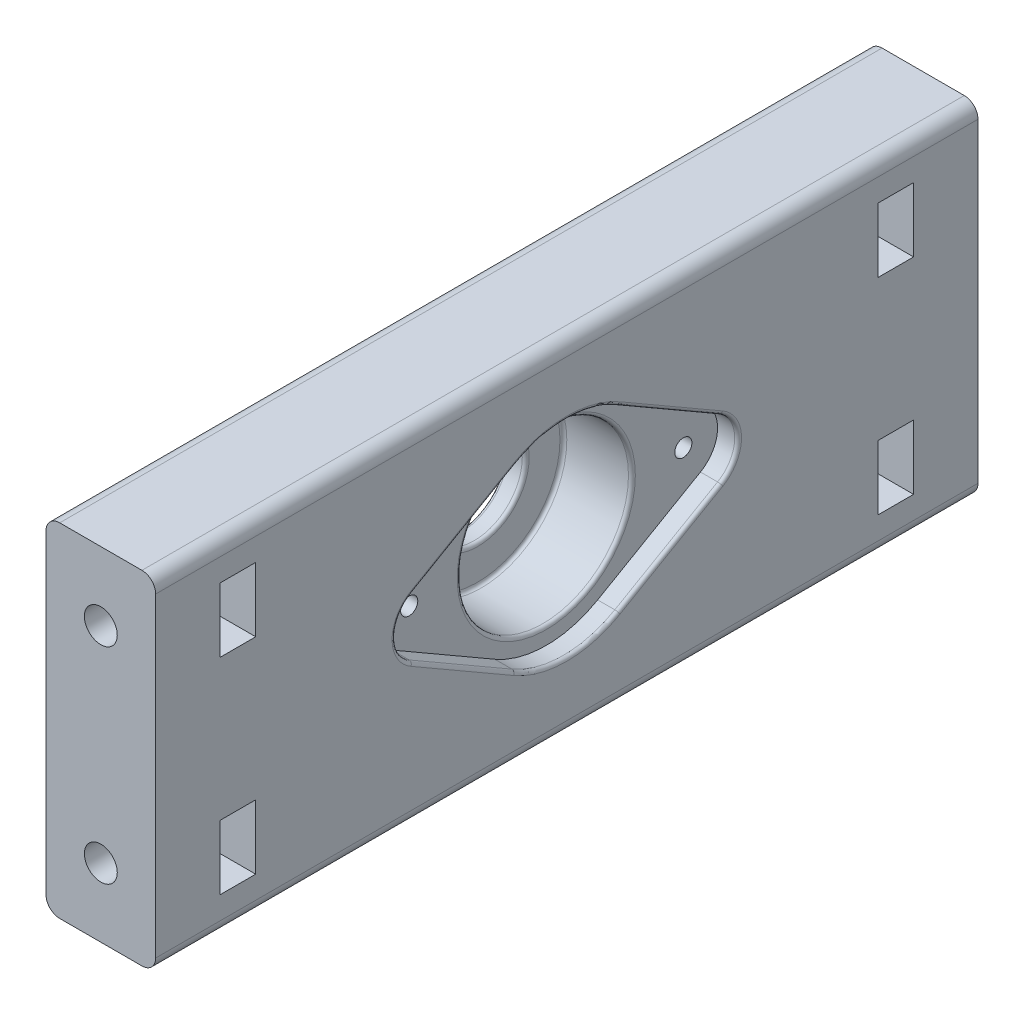
from build123d import *
from build123d.topology import SkipClean

# Parameters (mm, degrees)
SKETCH2_R                = 12.5
BOSS_EXTRUDE1_DEPTH      = 15
SKETCH13_W               = 16
SKETCH13_H               = 50
BOSS_EXTRUDE5_DEPTH      = 45
SKETCH14_R               = 12.5
CUT_EXTRUDE1_DEPTH       = 13
SKETCH15_R               = 1.25
CUT_EXTRUDE2_DEPTH       = 3
SKETCH16_R               = 7
SKETCH16_R_2             = 1.25
CUT_EXTRUDE3_DEPTH       = 116.628716156
FILLET3_R                = 0.5
FILLET4_R                = 0.5
FILLET5_R                = 0.5
BOSS_EXTRUDE7_DEPTH      = 15
BOSS_EXTRUDE8_START      = 10
SKETCH23_R               = 22
SKETCH23_R_2             = 12.5
BOSS_EXTRUDE8_DEPTH      = 10
SKETCH24_R               = 12.5
CUT_EXTRUDE4_DEPTH       = 147.049569685
SKETCH25_R               = 12.5
SKETCH25_R_2             = 7
BOSS_EXTRUDE9_DEPTH      = 2
CUT_EXTRUDE5_DEPTH       = 3
SKETCH27_R               = 1.15
CUT_EXTRUDE6_DEPTH       = 8
SKETCH28_R               = 20
BOSS_EXTRUDE10_DEPTH     = 2
BOSS_EXTRUDE11_DEPTH     = 20
SKETCH30_R               = 5
CUT_EXTRUDE7_DEPTH       = 10
SKETCH31_R               = 1.9
CUT_EXTRUDE8_DEPTH       = 12
CUT_EXTRUDE9_DEPTH       = 3
SKETCH33_R               = 1.15
CUT_EXTRUDE10_DEPTH      = 8
FILLET6_R                = 1
FILLET7_R                = 1
FILLET8_R                = 2
FILLET9_R                = 2
SKETCH35_R               = 2.4
CUT_EXTRUDE12_DEPTH      = 164.418104317
CUT_EXTRUDE15_DEPTH      = 153.743172808
SKETCH41_W               = 165.446496504
SKETCH41_H               = 185.397374106
CUT_EXTRUDE16_DEPTH      = 153.74317274
SKETCH42_R               = 2.4
BOSS_EXTRUDE12_DEPTH     = 30
SKETCH44_R               = 2.4
CUT_EXTRUDE17_DEPTH      = 2.6
MIRROR16_COPY_1_SKETCH_R = 2.4
MIRROR16_COPY_1_DEPTH    = 2.6


# Some blends are built 0.0001 mm under size
with BuildPart() as part:
    # Sketch2 → Boss-Extrude1 (new body)
    with BuildSketch(Plane.XY.offset(60)):
        with BuildLine():
            Line((-39.322032275, -7.333333333), (-28.508473399, -65.316666667))
            ThreePointArc((-28.508473399, -65.316666667), (0, -89), (28.508473399, -65.316666667))
            Line((28.508473399, -65.316666667), (39.322032275, -7.333333333))
            ThreePointArc((39.322032275, -7.333333333), (0, 40), (-39.322032275, -7.333333333))
        make_face()
        Circle(SKETCH2_R, mode=Mode.SUBTRACT)
    boss_extrude1 = extrude(amount=-BOSS_EXTRUDE1_DEPTH)

    # Sketch13 → Boss-Extrude5 (add)
    with BuildSketch(Plane(origin=(0, 0, 45), x_dir=(-1, 0, 0), z_dir=(0, 0, -1))):
        with Locations((5, -49)):
            Rectangle(SKETCH13_W, SKETCH13_H)
    boss_extrude5 = extrude(amount=BOSS_EXTRUDE5_DEPTH)

    # Mirror2: Boss-Extrude5 across plane
    add(boss_extrude5.mirror(Plane.XY))

    # Mirror4: Boss-Extrude1 across plane
    add(boss_extrude1.mirror(Plane.XY))

    # Sketch14 → Cut-Extrude1 (cut)
    with BuildSketch(Plane(origin=(3, 0, 0), x_dir=(0, 0, -1), z_dir=(1, 0, 0))):
        with Locations((0, -49)):
            Circle(SKETCH14_R)
    extrude(amount=-CUT_EXTRUDE1_DEPTH, mode=Mode.SUBTRACT)

    # Sketch15 → Cut-Extrude2 (cut)
    with BuildSketch(Plane(origin=(3, 0, 0), x_dir=(0, 0, -1), z_dir=(1, 0, 0))):
        with BuildLine():
            Line((-22.5, -44.669872981), (-7.5, -36.009618943))
            ThreePointArc((-7.5, -36.009618943), (0, -34), (7.5, -36.009618943))
            Line((7.5, -36.009618943), (22.5, -44.669872981))
            ThreePointArc((22.5, -44.669872981), (25, -49), (22.5, -53.330127019))
            Line((22.5, -53.330127019), (7.5, -61.990381057))
            ThreePointArc((7.5, -61.990381057), (0, -64), (-7.5, -61.990381057))
            Line((-7.5, -61.990381057), (-22.5, -53.330127019))
            ThreePointArc((-22.5, -53.330127019), (-25, -49), (-22.5, -44.669872981))
        make_face()
        with Locations((20, -49)):
            Circle(SKETCH15_R, mode=Mode.SUBTRACT)
        with Locations((-20, -49)):
            Circle(SKETCH15_R, mode=Mode.SUBTRACT)
    extrude(amount=-CUT_EXTRUDE2_DEPTH, mode=Mode.SUBTRACT)

    # Sketch16 → Cut-Extrude3 (cut, through all)
    with BuildSketch(Plane(origin=(3, 0, 0), x_dir=(0, 0, -1), z_dir=(1, 0, 0))):
        with Locations((0, -49)):
            Circle(SKETCH16_R)
        with Locations((20, -49)):
            Circle(SKETCH16_R_2)
        with Locations((-20, -49)):
            Circle(SKETCH16_R_2)
    extrude(amount=-CUT_EXTRUDE3_DEPTH, mode=Mode.SUBTRACT)

    # Fillet3
    fillet3_edges = [part.edges().sort_by_distance(p)[0] for p in [
        (-10, -49, 7),
        (-10, -49, 12.5),
        (0, -49, 12.5),
    ]]
    fillet(fillet3_edges, radius=FILLET3_R)

    # Fillet4
    fillet4_edges = [part.edges().sort_by_distance(p)[0] for p in [
        (-13, -49, 7),
    ]]
    fillet(fillet4_edges, radius=FILLET4_R)

    # Fillet5
    fillet5_edges = [part.edges().sort_by_distance(p)[0] for p in [
        (3, -49, 25),
        (3, -57.660254038, 15),
        (3, -64, 0),
        (3, -57.660254038, -15),
        (3, -49, -25),
        (3, -40.339745962, -15),
        (3, -34, 0),
        (3, -40.339745962, 15),
    ]]
    fillet(fillet5_edges, radius=FILLET5_R)

    # Sketch21 → Boss-Extrude7 (add)
    with BuildSketch(Plane(origin=(0, 0, 45), x_dir=(-1, 0, 0), z_dir=(0, 0, -1))):
        with BuildLine():
            Line((63.949121417, -39.274799426), (35.879526324, 17.682182861))
            ThreePointArc((35.879526324, 17.682182861), (39.626539296, 5.453199377), (39.322032275, -7.333333333))
            Line((39.322032275, -7.333333333), (32.183280175, -45.612002486))
            ThreePointArc((32.183280175, -45.612002486), (45.925459124, -36.617527064), (56.715381939, -49))
            ThreePointArc((56.715381939, -49), (43.626354657, -61.486114162), (31.770894441, -47.823254098))
            Line((31.770894441, -47.823254098), (28.508473399, -65.316666667))
            ThreePointArc((28.508473399, -65.316666667), (22.576057553, -78.202242316), (11.241719496, -86.732447377))
            Line((11.241719496, -86.732447377), (52.743582936, -69.279787666))
            ThreePointArc((52.743582936, -69.279787666), (64.82506776, -56.696807802), (63.949121417, -39.274799426))
        make_face()
        with BuildLine():
            ThreePointArc((39.322032275, -7.333333333), (39.626539296, 5.453199377), (35.879526324, 17.682182861))
            Line((35.879526324, 17.682182861), (11.241719496, -86.732447377))
            ThreePointArc((11.241719496, -86.732447377), (22.576057553, -78.202242316), (28.508473399, -65.316666667))
            Line((28.508473399, -65.316666667), (31.770894441, -47.823254098))
            ThreePointArc((31.770894441, -47.823254098), (31.927246853, -46.708333333), (32.183280175, -45.612002486))
            Line((32.183280175, -45.612002486), (39.322032275, -7.333333333))
        make_face()
    boss_extrude7 = extrude(amount=-BOSS_EXTRUDE7_DEPTH)

    # Sketch23 → Boss-Extrude8 (add)
    with SkipClean():  # the faces are left unmerged after this step: merging them gives an invalid solid
        with BuildSketch(Plane(origin=(0, 0, 45), x_dir=(-1, 0, 0), z_dir=(0, 0, -1)).offset(BOSS_EXTRUDE8_START)):
            with Locations((44.215381939, -49)):
                Circle(SKETCH23_R)
            with Locations((44.215381939, -49)):
                Circle(SKETCH23_R_2, mode=Mode.SUBTRACT)
        boss_extrude8 = extrude(amount=-BOSS_EXTRUDE8_DEPTH)

    # Sketch24 → Cut-Extrude4 (cut, through all)
    with SkipClean():  # the faces are left unmerged after this step: merging them gives an invalid solid
        with BuildSketch(Plane(origin=(0, 0, 35), x_dir=(-1, 0, 0), z_dir=(0, 0, -1))):
            with Locations((44.215381939, -49)):
                Circle(SKETCH24_R)
        cut_extrude4 = extrude(amount=-CUT_EXTRUDE4_DEPTH, mode=Mode.SUBTRACT)
    add(part.part.scale(1), mode=Mode.REPLACE)  # the faces are merged on a copy

    # Sketch25 → Boss-Extrude9 (add)
    with BuildSketch(Plane(origin=(0, 0, 35), x_dir=(-1, 0, 0), z_dir=(0, 0, -1))):
        with Locations((44.215381939, -49)):
            Circle(SKETCH25_R)
        with Locations((44.215381939, -49)):
            Circle(SKETCH25_R_2, mode=Mode.SUBTRACT)
    boss_extrude9 = extrude(amount=-BOSS_EXTRUDE9_DEPTH)

    # Sketch26 → Cut-Extrude5 (cut)
    with BuildSketch(Plane.XY.offset(60)):
        with BuildLine():
            Line((-34.573567794, -37.509333353), (-47.841846757, -26.375925369))
            ThreePointArc((-47.841846757, -26.375925369), (-52.765885522, -25.50768448), (-55.97982357, -29.337906696))
            Line((-55.97982357, -29.337906696), (-58.987498234, -46.395277335))
            ThreePointArc((-58.987498234, -46.395277335), (-58.310771251, -54.13030215), (-53.857196084, -60.490666647))
            Line((-53.857196084, -60.490666647), (-40.588917121, -71.624074631))
            ThreePointArc((-40.588917121, -71.624074631), (-35.664878356, -72.49231552), (-32.450940307, -68.662093304))
            Line((-32.450940307, -68.662093304), (-29.443265644, -51.604722665))
            ThreePointArc((-29.443265644, -51.604722665), (-30.119992627, -43.86969785), (-34.573567794, -37.509333353))
        make_face()
    cut_extrude5 = extrude(amount=-CUT_EXTRUDE5_DEPTH, mode=Mode.SUBTRACT)

    # Sketch27 → Cut-Extrude6 (cut)
    with BuildSketch(Plane.XY.offset(57)):
        with Locations((-51.055784805, -30.206147584)):
            Circle(SKETCH27_R)
        with Locations((-37.374979072, -67.793852416)):
            Circle(SKETCH27_R)
    cut_extrude6 = extrude(amount=-CUT_EXTRUDE6_DEPTH, mode=Mode.SUBTRACT)

    # Mirror12: Boss-Extrude7, Boss-Extrude8, Cut-Extrude4, Boss-Extrude9, Cut-Extrude5, Cut-Extrude6 across plane
    with SkipClean():  # the faces are left unmerged after this step: merging them gives an invalid solid
        add(boss_extrude7.mirror(Plane.XY))
        add(boss_extrude8.mirror(Plane.XY))
        add(cut_extrude4.mirror(Plane.XY), mode=Mode.SUBTRACT)
        add(boss_extrude9.mirror(Plane.XY))
        add(cut_extrude5.mirror(Plane.XY), mode=Mode.SUBTRACT)
        add(cut_extrude6.mirror(Plane.XY), mode=Mode.SUBTRACT)

    # Sketch28 → Boss-Extrude10 (add)
    with SkipClean():  # the faces are left unmerged after this step: merging them gives an invalid solid
        with BuildSketch(Plane(origin=(0, 0, 45), x_dir=(-1, 0, 0), z_dir=(0, 0, -1))):
            Circle(SKETCH28_R)
        boss_extrude10 = extrude(amount=-BOSS_EXTRUDE10_DEPTH)

    # Sketch29 → Boss-Extrude11 (add)
    with SkipClean():  # the faces are left unmerged after this step: merging them gives an invalid solid
        with BuildSketch(Plane(origin=(0, 0, 45), x_dir=(-1, 0, 0), z_dir=(0, 0, -1))):
            with BuildLine():
                Line((-20, 0), (20, 0))
                ThreePointArc((20, 0), (0, -20), (-20, 0))
            make_face()
        boss_extrude11 = extrude(amount=BOSS_EXTRUDE11_DEPTH)

    # Sketch30 → Cut-Extrude7 (cut)
    with SkipClean():  # the faces are left unmerged after this step: merging them gives an invalid solid
        with BuildSketch(Plane(origin=(0, 0, 25), x_dir=(-1, 0, 0), z_dir=(0, 0, -1))):
            Circle(SKETCH30_R)
        cut_extrude7 = extrude(amount=-CUT_EXTRUDE7_DEPTH, mode=Mode.SUBTRACT)

    # Sketch31 → Cut-Extrude8 (cut)
    with SkipClean():  # the faces are left unmerged after this step: merging them gives an invalid solid
        with BuildSketch(Plane(origin=(0, 0, 0), x_dir=(1, 0, 0), z_dir=(0, 1, 0))):
            with Locations(Location((-12.5, -35, 0), (0, 0, 270))):
                Circle(SKETCH31_R)
            with Locations(Location((12.5, -35, 0), (0, 0, 270))):
                Circle(SKETCH31_R)
        cut_extrude8 = extrude(amount=-CUT_EXTRUDE8_DEPTH, mode=Mode.SUBTRACT)

    # Sketch32 → Cut-Extrude9 (cut)
    with SkipClean():  # the faces are left unmerged after this step: merging them gives an invalid solid
        with BuildSketch(Plane(origin=(-30.922387151, 58.307855156, 60), x_dir=(0.34202014332566366, 0.9396926207859102, 0), z_dir=(0, 0, 1))):
            with BuildLine():
                Line((-34.573567794, -37.509333353), (-47.841846757, -26.375925369))
                ThreePointArc((-47.841846757, -26.375925369), (-52.765885522, -25.50768448), (-55.97982357, -29.337906696))
                Line((-55.97982357, -29.337906696), (-58.987498234, -46.395277335))
                ThreePointArc((-58.987498234, -46.395277335), (-58.310771251, -54.13030215), (-53.857196084, -60.490666647))
                Line((-53.857196084, -60.490666647), (-40.588917121, -71.624074631))
                ThreePointArc((-40.588917121, -71.624074631), (-35.664878356, -72.49231552), (-32.450940307, -68.662093304))
                Line((-32.450940307, -68.662093304), (-29.443265644, -51.604722665))
                ThreePointArc((-29.443265644, -51.604722665), (-30.119992627, -43.86969785), (-34.573567794, -37.509333353))
            make_face()
        cut_extrude9 = extrude(amount=-CUT_EXTRUDE9_DEPTH, mode=Mode.SUBTRACT)

    # Sketch33 → Cut-Extrude10 (cut)
    with SkipClean():  # the faces are left unmerged after this step: merging them gives an invalid solid
        with BuildSketch(Plane.XY.offset(57)):
            with Locations((20, 0)):
                Circle(SKETCH33_R)
            with Locations((-20, 0)):
                Circle(SKETCH33_R)
        cut_extrude10 = extrude(amount=-CUT_EXTRUDE10_DEPTH, mode=Mode.SUBTRACT)

    # Mirror13: Boss-Extrude10, Boss-Extrude11, Cut-Extrude7, Cut-Extrude8, Cut-Extrude9, Cut-Extrude10 across plane
    with SkipClean():  # the faces are left unmerged after this step: merging them gives an invalid solid
        add(boss_extrude10.mirror(Plane.XY))
        add(boss_extrude11.mirror(Plane.XY))
        add(cut_extrude7.mirror(Plane.XY), mode=Mode.SUBTRACT)
        add(cut_extrude8.mirror(Plane.XY), mode=Mode.SUBTRACT)
        add(cut_extrude9.mirror(Plane.XY), mode=Mode.SUBTRACT)
        add(cut_extrude10.mirror(Plane.XY), mode=Mode.SUBTRACT)

    # Fillet6
    # the kernel refuses this fillet: 1 mm, written as the material it takes off along each edge
    with BuildSketch(Plane(origin=(0, -60, 60), x_dir=(-0.38764549985050817, -0.9218085302521613, 0), z_dir=(-0.9218085302521613, 0.38764549985050817, 0))) as fillet6_piece_1:
        with BuildLine():
            CenterArc((29 - FILLET6_R, -FILLET6_R), FILLET6_R, 0, 90)
            Line((29 - FILLET6_R, 0), (29, 0))
            Line((29, 0), (29, -FILLET6_R))
        make_face()
    revolve(axis=Axis((0, -60, 60), (0, 0, 1)), revolution_arc=102.244097048, mode=Mode.SUBTRACT)
    with BuildSketch(Plane(origin=(0, -60, 45), x_dir=(-0.38764549985050817, -0.9218085302521613, 0), z_dir=(-0.9218085302521613, 0.38764549985050817, 0))) as fillet6_piece_2:
        with BuildLine():
            CenterArc((29 - FILLET6_R, FILLET6_R), FILLET6_R, 270, 90)
            Line((29, FILLET6_R), (29, 0))
            Line((29, 0), (29 - FILLET6_R, 0))
        make_face()
    revolve(axis=Axis((0, -60, 45), (0, 0, 1)), revolution_arc=102.244097048, mode=Mode.SUBTRACT)
    with BuildSketch(Plane(origin=(-63.949121417, -39.274799426, 60), x_dir=(0, 0, -1), z_dir=(0.4420545715370929, 0.8969881581064252, 0))) as fillet6_piece_3:
        with BuildLine():
            CenterArc((FILLET6_R, -FILLET6_R), FILLET6_R, 90, 90)
            Line((0, -FILLET6_R), (0, 0))
            Line((0, 0), (FILLET6_R, 0))
        make_face()
    extrude(amount=63.498031466, mode=Mode.SUBTRACT)
    with BuildSketch(Plane(origin=(-11.241719496, -86.732447377, 45), x_dir=(0.38764549985050845, 0.9218085302521613, 0), z_dir=(-0.9218085302521611, 0.38764549985050845, 0))) as fillet6_piece_4_section:
        with BuildLine():
            CenterArc((FILLET6_R, -FILLET6_R), FILLET6_R, 90, 90)
            Line((0, -FILLET6_R), (0, 0))
            Line((0, 0), (FILLET6_R, 0))
        make_face()
    fillet6_piece_4 = extrude(amount=52.522216738, mode=Mode.PRIVATE)
    fillet6_piece_4 = fillet6_piece_4 - Plane(origin=(-44.215381939, -49, 45), x_dir=(-1, 0, 0), z_dir=(0, 0, -1)) * Cylinder(22, 110, mode=Mode.PRIVATE)
    add(fillet6_piece_4, mode=Mode.SUBTRACT)
    with BuildSketch(Plane(origin=(-44.215381939, -49, 60), x_dir=(-0.3876454998505073, -0.9218085302521616, 0), z_dir=(0.9218085302521616, -0.3876454998505073, 0))) as fillet6_piece_5:
        with BuildLine():
            CenterArc((22 - FILLET6_R, FILLET6_R), FILLET6_R, 270, 90)
            Line((22 - FILLET6_R, 0), (22, 0))
            Line((22, 0), (22, FILLET6_R))
        make_face()
    revolve(axis=Axis((-44.215381939, -49, 60), (0, 0, -1)), revolution_arc=93.426969898, mode=Mode.SUBTRACT)
    with BuildSketch(Plane(origin=(-11.241719496, -86.732447377, 60), x_dir=(0, 0, -1), z_dir=(-0.9218085302521611, 0.38764549985050845, 0))) as fillet6_piece_6:
        with BuildLine():
            CenterArc((FILLET6_R, -FILLET6_R), FILLET6_R, 90, 90)
            Line((0, -FILLET6_R), (0, 0))
            Line((0, 0), (FILLET6_R, 0))
        make_face()
    extrude(amount=45.022216738, mode=Mode.SUBTRACT)
    with BuildSketch(Plane(origin=(-67.264530704, -46.002210612, 45), x_dir=(0.8969881581064253, -0.4420545715370929, 0), z_dir=(0.4420545715370929, 0.8969881581064252, 0))) as fillet6_piece_7_section:
        with BuildLine():
            CenterArc((FILLET6_R, -FILLET6_R), FILLET6_R, 90, 90)
            Line((0, -FILLET6_R), (0, 0))
            Line((0, 0), (FILLET6_R, 0))
        make_face()
    fillet6_piece_7 = extrude(amount=70.998031466, mode=Mode.PRIVATE)
    fillet6_piece_7 = fillet6_piece_7 - Plane(origin=(-44.215381939, -49, 45), x_dir=(-1, 0, 0), z_dir=(0, 0, -1)) * Cylinder(22, 146, mode=Mode.PRIVATE)
    add(fillet6_piece_7, mode=Mode.SUBTRACT)
    with BuildSketch(Plane(origin=(28.508473399, -65.316666667, 45), x_dir=(-0.9830508068705752, 0.18333333333333338, 0), z_dir=(0.1833333333333334, 0.9830508068705752, 0)), Plane(origin=(28.508473399, -65.316666667, 60), x_dir=(0, 0, -1), z_dir=(0.1833333333333334, 0.9830508068705752, 0))) as fillet6_piece_8:
        with BuildLine():
            CenterArc((FILLET6_R, FILLET6_R), FILLET6_R, 180, 90)
            Line((0, FILLET6_R), (0, 0))
            Line((0, 0), (FILLET6_R, 0))
        make_face()
    extrude(amount=58.983048412, mode=Mode.SUBTRACT)
    with BuildSketch(Plane(origin=(0, -60, -60), x_dir=(-0.38764549985050817, -0.9218085302521613, 0), z_dir=(-0.9218085302521613, 0.38764549985050817, 0))) as fillet6_piece_9:
        with BuildLine():
            CenterArc((29 - FILLET6_R, FILLET6_R), FILLET6_R, 270, 90)
            Line((29 - FILLET6_R, 0), (29, 0))
            Line((29, 0), (29, FILLET6_R))
        make_face()
    revolve(axis=Axis((0, -60, -60), (0, 0, 1)), revolution_arc=102.244097048, mode=Mode.SUBTRACT)
    with BuildSketch(Plane(origin=(0, -60, -45), x_dir=(-0.38764549985050817, -0.9218085302521613, 0), z_dir=(-0.9218085302521613, 0.38764549985050817, 0))) as fillet6_piece_10:
        with BuildLine():
            CenterArc((29 - FILLET6_R, -FILLET6_R), FILLET6_R, 0, 90)
            Line((29, -FILLET6_R), (29, 0))
            Line((29, 0), (29 - FILLET6_R, 0))
        make_face()
    revolve(axis=Axis((0, -60, -45), (0, 0, 1)), revolution_arc=102.244097048, mode=Mode.SUBTRACT)
    with BuildSketch(Plane(origin=(-11.241719496, -86.732447377, -60), x_dir=(0, 0, 1), z_dir=(-0.9218085302521611, 0.38764549985050845, 0))) as fillet6_piece_11:
        with BuildLine():
            CenterArc((FILLET6_R, FILLET6_R), FILLET6_R, 180, 90)
            Line((0, FILLET6_R), (0, 0))
            Line((0, 0), (FILLET6_R, 0))
        make_face()
    extrude(amount=45.022216738, mode=Mode.SUBTRACT)
    with BuildSketch(Plane(origin=(-44.215381939, -49, -60), x_dir=(-0.3876454998505073, -0.9218085302521616, 0), z_dir=(0.9218085302521616, -0.3876454998505073, 0))) as fillet6_piece_12:
        with BuildLine():
            CenterArc((22 - FILLET6_R, -FILLET6_R), FILLET6_R, 0, 90)
            Line((22 - FILLET6_R, 0), (22, 0))
            Line((22, 0), (22, -FILLET6_R))
        make_face()
    revolve(axis=Axis((-44.215381939, -49, -60), (0, 0, -1)), revolution_arc=93.426969898, mode=Mode.SUBTRACT)
    with BuildSketch(Plane(origin=(-67.264530704, -46.002210612, -45), x_dir=(0.8969881581064253, -0.4420545715370929, 0), z_dir=(0.4420545715370929, 0.8969881581064252, 0))) as fillet6_piece_13_section:
        with BuildLine():
            CenterArc((FILLET6_R, FILLET6_R), FILLET6_R, 180, 90)
            Line((0, FILLET6_R), (0, 0))
            Line((0, 0), (FILLET6_R, 0))
        make_face()
    fillet6_piece_13 = extrude(amount=70.998031466, mode=Mode.PRIVATE)
    fillet6_piece_13 = fillet6_piece_13 - Plane(origin=(-44.215381939, -49, -45), x_dir=(-1, 0, 0), z_dir=(0, 0, 1)) * Cylinder(22, 146, mode=Mode.PRIVATE)
    add(fillet6_piece_13, mode=Mode.SUBTRACT)
    with BuildSketch(Plane(origin=(-63.949121417, -39.274799426, -60), x_dir=(0, 0, 1), z_dir=(0.4420545715370929, 0.8969881581064252, 0))) as fillet6_piece_14:
        with BuildLine():
            CenterArc((FILLET6_R, FILLET6_R), FILLET6_R, 180, 90)
            Line((0, FILLET6_R), (0, 0))
            Line((0, 0), (FILLET6_R, 0))
        make_face()
    extrude(amount=63.498031466, mode=Mode.SUBTRACT)
    with BuildSketch(Plane(origin=(-11.241719496, -86.732447377, -45), x_dir=(0.38764549985050845, 0.9218085302521613, 0), z_dir=(-0.9218085302521611, 0.38764549985050845, 0))) as fillet6_piece_15_section:
        with BuildLine():
            CenterArc((FILLET6_R, FILLET6_R), FILLET6_R, 180, 90)
            Line((0, FILLET6_R), (0, 0))
            Line((0, 0), (FILLET6_R, 0))
        make_face()
    fillet6_piece_15 = extrude(amount=52.522216738, mode=Mode.PRIVATE)
    fillet6_piece_15 = fillet6_piece_15 - Plane(origin=(-44.215381939, -49, -45), x_dir=(-1, 0, 0), z_dir=(0, 0, 1)) * Cylinder(22, 110, mode=Mode.PRIVATE)
    add(fillet6_piece_15, mode=Mode.SUBTRACT)
    with BuildSketch(Plane(origin=(0, 0, -45), x_dir=(0.9830508068705752, -0.18333333333333324, 0), z_dir=(-0.18333333333333324, -0.9830508068705752, 0))) as fillet6_piece_16:
        with BuildLine():
            CenterArc((40 - FILLET6_R, -FILLET6_R), FILLET6_R, 0, 90)
            Line((40, -FILLET6_R), (40, 0))
            Line((40, 0), (40 - FILLET6_R, 0))
        make_face()
    revolve(axis=Axis((0, 0, -45), (0, 0, 1)), revolution_arc=164.328933054, mode=Mode.SUBTRACT)
    with BuildSketch(Plane(origin=(28.508473399, -65.316666667, -45), x_dir=(-0.9830508068705752, 0.18333333333333338, 0), z_dir=(0.1833333333333334, 0.9830508068705752, 0)), Plane(origin=(28.508473399, -65.316666667, -60), x_dir=(0, 0, 1), z_dir=(0.1833333333333334, 0.9830508068705752, 0))) as fillet6_piece_17:
        with BuildLine():
            CenterArc((FILLET6_R, -FILLET6_R), FILLET6_R, 90, 90)
            Line((0, -FILLET6_R), (0, 0))
            Line((0, 0), (FILLET6_R, 0))
        make_face()
    extrude(amount=58.983048412, mode=Mode.SUBTRACT)
    with BuildSketch(Plane(origin=(0, 0, -60), x_dir=(0.9830508068705752, -0.18333333333333324, 0), z_dir=(-0.18333333333333324, -0.9830508068705752, 0))) as fillet6_piece_18:
        with BuildLine():
            CenterArc((40 - FILLET6_R, FILLET6_R), FILLET6_R, 270, 90)
            Line((40 - FILLET6_R, 0), (40, 0))
            Line((40, 0), (40, FILLET6_R))
        make_face()
    revolve(axis=Axis((0, 0, -60), (0, 0, 1)), revolution_arc=164.328933054, mode=Mode.SUBTRACT)
    with BuildSketch(Plane(origin=(0, 0, 45), x_dir=(0.9830508068705752, -0.18333333333333324, 0), z_dir=(-0.18333333333333324, -0.9830508068705752, 0))) as fillet6_piece_19:
        with BuildLine():
            CenterArc((40 - FILLET6_R, FILLET6_R), FILLET6_R, 270, 90)
            Line((40, FILLET6_R), (40, 0))
            Line((40, 0), (40 - FILLET6_R, 0))
        make_face()
    revolve(axis=Axis((0, 0, 45), (0, 0, 1)), revolution_arc=164.328933054, mode=Mode.SUBTRACT)
    with BuildSketch(Plane(origin=(0, 0, 60), x_dir=(0.9830508068705752, -0.18333333333333324, 0), z_dir=(-0.18333333333333324, -0.9830508068705752, 0))) as fillet6_piece_20:
        with BuildLine():
            CenterArc((40 - FILLET6_R, -FILLET6_R), FILLET6_R, 0, 90)
            Line((40 - FILLET6_R, 0), (40, 0))
            Line((40, 0), (40, -FILLET6_R))
        make_face()
    revolve(axis=Axis((0, 0, 60), (0, 0, 1)), revolution_arc=164.328933054, mode=Mode.SUBTRACT)

    # Fillet7
    fillet7_edges = [part.edges().sort_by_distance(p)[0] for p in [
        (0, -20, 45),
        (20, 0, 35),
        (0, 0, 45),
        (-20, 0, 35),
        (0, -20, 25),
        (-12.5, 0, 25),
        (12.5, 0, 25),
        (0, -5, 25),
        (0, -20, -25),
        (-20, 0, -35),
        (-12.5, 0, -25),
        (20, 0, -35),
        (0, -20, -45),
        (0, 0, -45),
        (12.5, 0, -25),
        (0, -5, -25),
    ]]
    fillet(fillet7_edges, radius=FILLET7_R)

    # Fillet8
    fillet8_edges = [part.edges().sort_by_distance(p)[0] for p in [
        (-13, -24, 0),
        (-13, -74, 0),
        (3, -74, 0),
        (3, -24, 0),
    ]]
    fillet(fillet8_edges, radius=FILLET8_R)

    # Fillet9
    fillet9_edges = [part.edges().sort_by_distance(p)[0] for p in [
        (-22.215381939, -49, 35),
        (-37.215381939, -49, 35),
        (-22.215381939, -49, -35),
        (-37.215381939, -49, -35),
    ]]
    fillet(fillet9_edges, radius=FILLET9_R - 0.0001)  # a hair under: the kernel refuses the full size

    # Sketch35 → Cut-Extrude12 (cut, through all)
    with BuildSketch(Plane.XY.offset(60)):
        with Locations((-5, -34)):
            Circle(SKETCH35_R)
        with Locations((-5, -64)):
            Circle(SKETCH35_R)
    extrude(amount=-CUT_EXTRUDE12_DEPTH, mode=Mode.SUBTRACT)

    # Sketch38 → Cut-Extrude15 (cut, through all)
    with BuildSketch(Plane.XY.offset(-45)):
        with BuildLine():
            Line((-34.982538166, 17.24012829), (-60.153387582, -33.834909294))
            ThreePointArc((-60.153387582, -33.834909294), (-23.605696117, -41.303192198), (-46.311234667, -70.89994067))
            Line((-46.311234667, -70.89994067), (-10.854073996, -85.810638847))
            ThreePointArc((-10.854073996, -85.810638847), (13.280482176, -84.65012765), (27.525422592, -65.133333333))
            Line((27.525422592, -65.133333333), (38.338981468, -7.15))
            ThreePointArc((38.338981468, -7.15), (12.309996645, 37.006269504), (-34.982538166, 17.24012829))
        make_face()
        with BuildLine():
            ThreePointArc((-11, -74), (-12.414213562, -73.414213562), (-13, -72))
            Line((-13, -72), (-13, -26))
            ThreePointArc((-13, -26), (-12.414213562, -24.585786438), (-11, -24))
            Line((-11, -24), (1, -24))
            ThreePointArc((1, -24), (2.414213562, -24.585786438), (3, -26))
            Line((3, -26), (3, -72))
            ThreePointArc((3, -72), (2.414213562, -73.414213562), (1, -74))
            Line((1, -74), (-11, -74))
        make_face(mode=Mode.SUBTRACT)
        with BuildLine():
            ThreePointArc((20.970893957, -1.105263158), (0, -21), (-20.970893957, -1.105263158))
            ThreePointArc((-20.970893957, -1.105263158), (-20.424618461, 0.376494403), (-18.973665961, 1))
            Line((-18.973665961, 1), (18.973665961, 1))
            ThreePointArc((18.973665961, 1), (20.424618461, 0.376494403), (20.970893957, -1.105263158))
        make_face(mode=Mode.SUBTRACT)
    extrude(amount=-CUT_EXTRUDE15_DEPTH, mode=Mode.SUBTRACT)


with BuildPart() as body_2:
    # of the pieces the cut leaves, the one that is kept (cut_extrude15_keep)
    add(part.part.solids().sort_by_distance((-13, -26, 45))[0])

    # Sketch41 → Cut-Extrude16 (cut, through all)
    with BuildSketch(Plane(origin=(0, 0, 45), x_dir=(-1, 0, 0), z_dir=(0, 0, -1))):
        Rectangle(SKETCH41_W, SKETCH41_H)
        with BuildLine():
            Line((13, -72), (13, -26))
            ThreePointArc((13, -26), (12.414213562, -24.585786438), (11, -24))
            Line((11, -24), (-1, -24))
            ThreePointArc((-1, -24), (-2.414213562, -24.585786438), (-3, -26))
            Line((-3, -26), (-3, -72))
            ThreePointArc((-3, -72), (-2.414213562, -73.414213562), (-1, -74))
            Line((-1, -74), (11, -74))
            ThreePointArc((11, -74), (12.414213562, -73.414213562), (13, -72))
        make_face(mode=Mode.SUBTRACT)
    extrude(amount=-CUT_EXTRUDE16_DEPTH, mode=Mode.SUBTRACT)


with BuildPart() as body_2_2:
    # of the pieces the cut leaves, the one that is kept (cut_extrude16_keep)
    add(body_2.part.solids().sort_by_distance((-13, -72, -60))[0])

    # Sketch42 → Boss-Extrude12 (add, symmetric)
    with BuildSketch(Plane.XY):
        with Locations((-5, -34)):
            Circle(SKETCH42_R)
        with Locations((-5, -64)):
            Circle(SKETCH42_R)
    extrude(amount=BOSS_EXTRUDE12_DEPTH, both=True)

    # Sketch44 → Cut-Extrude17 (cut, symmetric)
    # profile 1 of 2: a face of its own
    with BuildSketch(Plane(origin=(0, 0, -48), x_dir=(-1, 0, 0), z_dir=(0, 0, -1))):
        Polygon((2.286453735, -38.7), (7.713546265, -38.7), (10.42709253, -34), (7.713546265, -29.3), (2.286453735, -29.3), (-0.42709253, -34), align=None)
        with Locations(Location((5, -34, 0), (0, 0, 180))):
            Circle(SKETCH44_R, mode=Mode.SUBTRACT)
    # profile 2 of 2: a face of its own
    with BuildSketch(Plane(origin=(0, 0, -48), x_dir=(-1, 0, 0), z_dir=(0, 0, -1))):
        Polygon((-3, -38.7), (-3, -29.3), (2.286453735, -29.3), (-0.42709253, -34), (2.286453735, -38.7), align=None)
    cut_extrude17 = extrude(amount=CUT_EXTRUDE17_DEPTH, both=True, mode=Mode.SUBTRACT)

    # Mirror15: Cut-Extrude17 across plane
    add(cut_extrude17.mirror(Plane(origin=(0, -49, 0), x_dir=(0, 0, 1), z_dir=(0, -1, 0))), mode=Mode.SUBTRACT)

    # Mirror16: Cut-Extrude17 across plane
    add(cut_extrude17.mirror(Plane.XY), mode=Mode.SUBTRACT)

    # Mirror16 copy 1 sketch → Mirror16 copy 1 (cut, symmetric)
    # profile 1 of 2: a face of its own
    with BuildSketch(Plane(origin=(0, -98, 48), x_dir=(-1, 0, 0), z_dir=(0, 0, 1))):
        Polygon((2.286453735, -38.7), (7.713546265, -38.7), (10.42709253, -34), (7.713546265, -29.3), (2.286453735, -29.3), (-0.42709253, -34), align=None)
        with Locations(Location((5, -34, 0), (0, 0, 180))):
            Circle(MIRROR16_COPY_1_SKETCH_R, mode=Mode.SUBTRACT)
    # profile 2 of 2: a face of its own
    with BuildSketch(Plane(origin=(0, -98, 48), x_dir=(-1, 0, 0), z_dir=(0, 0, 1))):
        Polygon((-3, -38.7), (-3, -29.3), (2.286453735, -29.3), (-0.42709253, -34), (2.286453735, -38.7), align=None)
    extrude(amount=MIRROR16_COPY_1_DEPTH, both=True, mode=Mode.SUBTRACT)


solid = body_2_2.part
